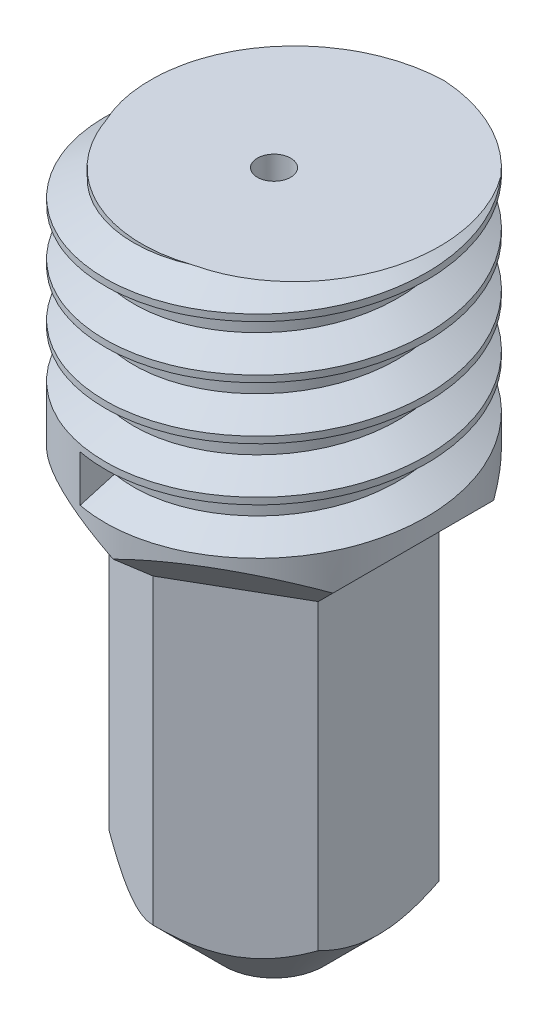
from build123d import *

# Parameters (mm, degrees)
SKETCH2_OUTSIDE_W  = 9.248
SKETCH2_OUTSIDE_H  = 9.248
CUT_EXTRUDE1_DEPTH = 7
CHAMFER2_SIZE      = 1.4
THREAD2_PITCH      = 0.79375


with BuildPart() as part:
    # Sketch1 → Revolve1 (revolve)
    with BuildSketch(Plane.XY, mode=Mode.PRIVATE) as revolve1_sk:
        Polygon((-0.25, 10), (-0.25, 0), (-0.75, 0), (-1.813, 1.063), (-1.813, 7), (-2.413, 7), (-2.413, 10), align=None)
    revolve(revolve1_sk.sketch.rotate(Axis((0, 0, 0), (0, 1, 0)), 270), axis=Axis((0, 0, 0), (0, 1, 0)))

    # Sketch2 outside → Cut-Extrude1 (cut)
    with BuildSketch(Plane.XZ):
        Rectangle(SKETCH2_OUTSIDE_W, SKETCH2_OUTSIDE_H)
        Polygon((0, 1.813), (-1.570104057, 0.9065), (-1.570104057, -0.9065), (0, -1.813), (1.570104057, -0.9065), (1.570104057, 0.9065), align=None, mode=Mode.SUBTRACT)
    extrude(amount=-CUT_EXTRUDE1_DEPTH, mode=Mode.SUBTRACT)

    # Chamfer2
    # the kernel refuses this chamfer: 1.4 mm, written as the material it adds along each edge
    with BuildSketch(Plane(origin=(4.688103974, 7, -0.893678092), x_dir=(0.4998109584556482, 0.02749587661058613, 0.8656979742248805), z_dir=(-0.8660254037844388, 0, 0.49999999999999983))) as chamfer2_piece_1_section:
        Polygon((CHAMFER2_SIZE * 0.999621916911, -CHAMFER2_SIZE * 0.0274958766106), (-CHAMFER2_SIZE * 0.0274958766106, -CHAMFER2_SIZE * 0.999621916911), (0, 0), align=None)
    chamfer2_piece_1 = extrude(amount=9.013712366, mode=Mode.PRIVATE)
    chamfer2_piece_1 = chamfer2_piece_1 & Plane(origin=(0, 6.446874687, 0), x_dir=(0, 0, -1), z_dir=(0, 1, 0)) * Cylinder(2.413, 24, mode=Mode.PRIVATE)
    chamfer2_piece_1 = split(chamfer2_piece_1, bisect_by=Plane(origin=(0.609740545, 6.446874687, 2.165033868), z_dir=(0.4999999999999998, 0, -0.8660254037844388)), keep=Keep.TOP, mode=Mode.PRIVATE)
    chamfer2_piece_1 = split(chamfer2_piece_1, bisect_by=Plane(origin=(1.570104057, 6.446874687, 1.610567736), z_dir=(-1, 0, 0)), keep=Keep.TOP, mode=Mode.PRIVATE)
    add(chamfer2_piece_1)
    with BuildSketch(Plane(origin=(3.117999917, 7, 3.613178092), x_dir=(-0.4998109584556481, 0.027495876610586115, 0.8656979742248805), z_dir=(-0.8660254037844388, 0, -0.4999999999999998))) as chamfer2_piece_2_section:
        Polygon((CHAMFER2_SIZE * 0.999621916911, -CHAMFER2_SIZE * 0.0274958766106), (-CHAMFER2_SIZE * 0.0274958766106, -CHAMFER2_SIZE * 0.999621916911), (0, 0), align=None)
    chamfer2_piece_2 = extrude(amount=9.013712366, mode=Mode.PRIVATE)
    chamfer2_piece_2 = chamfer2_piece_2 & Plane(origin=(0, 6.446874687, 0), x_dir=(0, 0, -1), z_dir=(0, 1, 0)) * Cylinder(2.413, 24, mode=Mode.PRIVATE)
    chamfer2_piece_2 = split(chamfer2_piece_2, bisect_by=Plane(origin=(-1.570104057, 6.446874687, 1.610567736), z_dir=(1, 0, 0)), keep=Keep.TOP, mode=Mode.PRIVATE)
    chamfer2_piece_2 = split(chamfer2_piece_2, bisect_by=Plane(origin=(-0.609740545, 6.446874687, 2.165033868), z_dir=(-0.49999999999999983, 0, -0.8660254037844388)), keep=Keep.TOP, mode=Mode.PRIVATE)
    add(chamfer2_piece_2)
    with BuildSketch(Plane(origin=(-1.570104057, 7, 4.506856183), x_dir=(-0.9996219169112968, 0.027495876610586115, 0), z_dir=(0, 0, -1))) as chamfer2_piece_3_section:
        Polygon((CHAMFER2_SIZE * 0.999621916911, -CHAMFER2_SIZE * 0.0274958766106), (-CHAMFER2_SIZE * 0.0274958766106, -CHAMFER2_SIZE * 0.999621916911), (0, 0), align=None)
    chamfer2_piece_3 = extrude(amount=9.013712366, mode=Mode.PRIVATE)
    chamfer2_piece_3 = chamfer2_piece_3 & Plane(origin=(0, 6.446874687, 0), x_dir=(0, 0, -1), z_dir=(0, 1, 0)) * Cylinder(2.413, 24, mode=Mode.PRIVATE)
    chamfer2_piece_3 = split(chamfer2_piece_3, bisect_by=Plane(origin=(-2.179844602, 6.446874687, -0.554466132), z_dir=(0.49999999999999956, 0, 0.8660254037844389)), keep=Keep.TOP, mode=Mode.PRIVATE)
    chamfer2_piece_3 = split(chamfer2_piece_3, bisect_by=Plane(origin=(-2.179844602, 6.446874687, 0.554466132), z_dir=(0.4999999999999998, 0, -0.8660254037844388)), keep=Keep.TOP, mode=Mode.PRIVATE)
    add(chamfer2_piece_3)
    with BuildSketch(Plane(origin=(-4.688103974, 7, 0.893678092), x_dir=(-0.49981095845564794, 0.027495876610586122, -0.8656979742248805), z_dir=(0.8660254037844389, 0, -0.49999999999999956))) as chamfer2_piece_4_section:
        Polygon((CHAMFER2_SIZE * 0.999621916911, -CHAMFER2_SIZE * 0.0274958766106), (-CHAMFER2_SIZE * 0.0274958766106, -CHAMFER2_SIZE * 0.999621916911), (0, 0), align=None)
    chamfer2_piece_4 = extrude(amount=9.013712366, mode=Mode.PRIVATE)
    chamfer2_piece_4 = chamfer2_piece_4 & Plane(origin=(0, 6.446874688, 0), x_dir=(0, 0, -1), z_dir=(0, 1, 0)) * Cylinder(2.413, 24, mode=Mode.PRIVATE)
    chamfer2_piece_4 = split(chamfer2_piece_4, bisect_by=Plane(origin=(-0.609740545, 6.446874688, -2.165033868), z_dir=(-0.4999999999999996, 0, 0.8660254037844389)), keep=Keep.TOP, mode=Mode.PRIVATE)
    chamfer2_piece_4 = split(chamfer2_piece_4, bisect_by=Plane(origin=(-1.570104057, 6.446874688, -1.610567735), z_dir=(1, 0, 0)), keep=Keep.TOP, mode=Mode.PRIVATE)
    add(chamfer2_piece_4)
    with BuildSketch(Plane(origin=(1.570104057, 7, -4.506856183), x_dir=(0.9996219169112968, 0.027495876610586115, 0), z_dir=(0, 0, 1))) as chamfer2_piece_5_section:
        Polygon((CHAMFER2_SIZE * 0.999621916911, -CHAMFER2_SIZE * 0.0274958766106), (-CHAMFER2_SIZE * 0.0274958766106, -CHAMFER2_SIZE * 0.999621916911), (0, 0), align=None)
    chamfer2_piece_5 = extrude(amount=9.013712366, mode=Mode.PRIVATE)
    chamfer2_piece_5 = chamfer2_piece_5 & Plane(origin=(0, 6.446874687, 0), x_dir=(0, 0, -1), z_dir=(0, 1, 0)) * Cylinder(2.413, 24, mode=Mode.PRIVATE)
    chamfer2_piece_5 = split(chamfer2_piece_5, bisect_by=Plane(origin=(2.179844602, 6.446874687, 0.554466132), z_dir=(-0.49999999999999983, 0, -0.8660254037844388)), keep=Keep.TOP, mode=Mode.PRIVATE)
    chamfer2_piece_5 = split(chamfer2_piece_5, bisect_by=Plane(origin=(2.179844602, 6.446874687, -0.554466132), z_dir=(-0.4999999999999996, 0, 0.8660254037844389)), keep=Keep.TOP, mode=Mode.PRIVATE)
    add(chamfer2_piece_5)
    with BuildSketch(Plane(origin=(-3.117999917, 7, -3.613178092), x_dir=(0.49981095845564794, 0.027495876610586112, -0.8656979742248806), z_dir=(0.8660254037844389, 0, 0.4999999999999996))) as chamfer2_piece_6_section:
        Polygon((CHAMFER2_SIZE * 0.999621916911, -CHAMFER2_SIZE * 0.0274958766106), (-CHAMFER2_SIZE * 0.0274958766106, -CHAMFER2_SIZE * 0.999621916911), (0, 0), align=None)
    chamfer2_piece_6 = extrude(amount=9.013712366, mode=Mode.PRIVATE)
    chamfer2_piece_6 = chamfer2_piece_6 & Plane(origin=(0, 6.446874688, 0), x_dir=(0, 0, -1), z_dir=(0, 1, 0)) * Cylinder(2.413, 24, mode=Mode.PRIVATE)
    chamfer2_piece_6 = split(chamfer2_piece_6, bisect_by=Plane(origin=(0.609740544, 6.446874688, -2.165033867), z_dir=(0.49999999999999956, 0, 0.8660254037844389)), keep=Keep.TOP, mode=Mode.PRIVATE)
    chamfer2_piece_6 = split(chamfer2_piece_6, bisect_by=Plane(origin=(1.570104057, 6.446874688, -1.610567736), z_dir=(-1, 0, 0)), keep=Keep.TOP, mode=Mode.PRIVATE)
    add(chamfer2_piece_6)
    with BuildSketch(Plane(origin=(4.688103974, 7, -0.893678092), x_dir=(0.4998109584556482, 0.02749587661058613, 0.8656979742248805), z_dir=(-0.8660254037844388, 0, 0.49999999999999983))) as chamfer2_piece_7a_section:
        Polygon((CHAMFER2_SIZE * 0.999621916911, -CHAMFER2_SIZE * 0.0274958766106), (-CHAMFER2_SIZE * 0.0274958766106, -CHAMFER2_SIZE * 0.999621916911), (0, 0), align=None)
    chamfer2_piece_7a = extrude(amount=9.013712366, mode=Mode.PRIVATE)
    chamfer2_piece_7a = chamfer2_piece_7a & Plane(origin=(0, 6.430993717, 0), x_dir=(0, 0, -1), z_dir=(0, 1, 0)) * Cylinder(2.413, 24, mode=Mode.PRIVATE)
    chamfer2_piece_7a = split(chamfer2_piece_7a, bisect_by=Plane(origin=(1.570104057, 6.430993717, 1.01029704), z_dir=(1, 0, 0)), keep=Keep.TOP, mode=Mode.PRIVATE)
    with BuildSketch(Plane(origin=(1.570104057, 7, -4.506856183), x_dir=(0.9996219169112968, 0.027495876610586115, 0), z_dir=(0, 0, 1))) as chamfer2_piece_7b_section:
        Polygon((CHAMFER2_SIZE * 0.999621916911, -CHAMFER2_SIZE * 0.0274958766106), (-CHAMFER2_SIZE * 0.0274958766106, -CHAMFER2_SIZE * 0.999621916911), (0, 0), align=None)
    chamfer2_piece_7b = extrude(amount=9.013712366, mode=Mode.PRIVATE)
    chamfer2_piece_7b = chamfer2_piece_7b & Plane(origin=(0, 6.430993714, 0), x_dir=(0, 0, -1), z_dir=(0, 1, 0)) * Cylinder(2.413, 24, mode=Mode.PRIVATE)
    chamfer2_piece_7b = split(chamfer2_piece_7b, bisect_by=Plane(origin=(1.65999493, 6.430993714, 0.85460148), z_dir=(0.49999999999999983, 0, 0.8660254037844388)), keep=Keep.TOP, mode=Mode.PRIVATE)
    chamfer2_piece_7 = chamfer2_piece_7a & chamfer2_piece_7b
    add(chamfer2_piece_7)
    with BuildSketch(Plane(origin=(3.117999917, 7, 3.613178092), x_dir=(-0.4998109584556481, 0.027495876610586115, 0.8656979742248805), z_dir=(-0.8660254037844388, 0, -0.4999999999999998))) as chamfer2_piece_8a_section:
        Polygon((CHAMFER2_SIZE * 0.999621916911, -CHAMFER2_SIZE * 0.0274958766106), (-CHAMFER2_SIZE * 0.0274958766106, -CHAMFER2_SIZE * 0.999621916911), (0, 0), align=None)
    chamfer2_piece_8a = extrude(amount=9.013712366, mode=Mode.PRIVATE)
    chamfer2_piece_8a = chamfer2_piece_8a & Plane(origin=(0, 6.430993717, 0), x_dir=(0, 0, -1), z_dir=(0, 1, 0)) * Cylinder(2.413, 24, mode=Mode.PRIVATE)
    chamfer2_piece_8a = split(chamfer2_piece_8a, bisect_by=Plane(origin=(-0.089890874, 6.430993717, 1.86489852), z_dir=(0.49999999999999983, 0, 0.8660254037844388)), keep=Keep.TOP, mode=Mode.PRIVATE)
    with BuildSketch(Plane(origin=(4.688103974, 7, -0.893678092), x_dir=(0.4998109584556482, 0.02749587661058613, 0.8656979742248805), z_dir=(-0.8660254037844388, 0, 0.49999999999999983))) as chamfer2_piece_8b_section:
        Polygon((CHAMFER2_SIZE * 0.999621916911, -CHAMFER2_SIZE * 0.0274958766106), (-CHAMFER2_SIZE * 0.0274958766106, -CHAMFER2_SIZE * 0.999621916911), (0, 0), align=None)
    chamfer2_piece_8b = extrude(amount=9.013712366, mode=Mode.PRIVATE)
    chamfer2_piece_8b = chamfer2_piece_8b & Plane(origin=(0, 6.430993714, 0), x_dir=(0, 0, -1), z_dir=(0, 1, 0)) * Cylinder(2.413, 24, mode=Mode.PRIVATE)
    chamfer2_piece_8b = split(chamfer2_piece_8b, bisect_by=Plane(origin=(0.089890873, 6.430993714, 1.864898519), z_dir=(-0.4999999999999998, 0, 0.8660254037844388)), keep=Keep.TOP, mode=Mode.PRIVATE)
    chamfer2_piece_8 = chamfer2_piece_8a & chamfer2_piece_8b
    add(chamfer2_piece_8)
    with BuildSketch(Plane(origin=(-1.570104057, 7, 4.506856183), x_dir=(-0.9996219169112968, 0.027495876610586115, 0), z_dir=(0, 0, -1))) as chamfer2_piece_9a_section:
        Polygon((CHAMFER2_SIZE * 0.999621916911, -CHAMFER2_SIZE * 0.0274958766106), (-CHAMFER2_SIZE * 0.0274958766106, -CHAMFER2_SIZE * 0.999621916911), (0, 0), align=None)
    chamfer2_piece_9a = extrude(amount=9.013712366, mode=Mode.PRIVATE)
    chamfer2_piece_9a = chamfer2_piece_9a & Plane(origin=(0, 6.430993706, 0), x_dir=(0, 0, -1), z_dir=(0, 1, 0)) * Cylinder(2.413, 24, mode=Mode.PRIVATE)
    chamfer2_piece_9a = split(chamfer2_piece_9a, bisect_by=Plane(origin=(-1.659994936, 6.430993706, 0.854601477), z_dir=(-0.4999999999999998, 0, 0.8660254037844388)), keep=Keep.TOP, mode=Mode.PRIVATE)
    with BuildSketch(Plane(origin=(3.117999917, 7, 3.613178092), x_dir=(-0.4998109584556481, 0.027495876610586115, 0.8656979742248805), z_dir=(-0.8660254037844388, 0, -0.4999999999999998))) as chamfer2_piece_9b_section:
        Polygon((CHAMFER2_SIZE * 0.999621916911, -CHAMFER2_SIZE * 0.0274958766106), (-CHAMFER2_SIZE * 0.0274958766106, -CHAMFER2_SIZE * 0.999621916911), (0, 0), align=None)
    chamfer2_piece_9b = extrude(amount=9.013712366, mode=Mode.PRIVATE)
    chamfer2_piece_9b = chamfer2_piece_9b & Plane(origin=(0, 6.430993714, 0), x_dir=(0, 0, -1), z_dir=(0, 1, 0)) * Cylinder(2.413, 24, mode=Mode.PRIVATE)
    chamfer2_piece_9b = split(chamfer2_piece_9b, bisect_by=Plane(origin=(-1.570104057, 6.430993714, 1.010297039), z_dir=(-1, 0, 0)), keep=Keep.TOP, mode=Mode.PRIVATE)
    chamfer2_piece_9 = chamfer2_piece_9a & chamfer2_piece_9b
    add(chamfer2_piece_9)
    with BuildSketch(Plane(origin=(-4.688103974, 7, 0.893678092), x_dir=(-0.49981095845564794, 0.027495876610586122, -0.8656979742248805), z_dir=(0.8660254037844389, 0, -0.49999999999999956))) as chamfer2_piece_10a_section:
        Polygon((CHAMFER2_SIZE * 0.999621916911, -CHAMFER2_SIZE * 0.0274958766106), (-CHAMFER2_SIZE * 0.0274958766106, -CHAMFER2_SIZE * 0.999621916911), (0, 0), align=None)
    chamfer2_piece_10a = extrude(amount=9.013712366, mode=Mode.PRIVATE)
    chamfer2_piece_10a = chamfer2_piece_10a & Plane(origin=(0, 6.430993717, 0), x_dir=(0, 0, -1), z_dir=(0, 1, 0)) * Cylinder(2.413, 24, mode=Mode.PRIVATE)
    chamfer2_piece_10a = split(chamfer2_piece_10a, bisect_by=Plane(origin=(-1.570104057, 6.430993717, -1.01029704), z_dir=(-1, 0, 0)), keep=Keep.TOP, mode=Mode.PRIVATE)
    with BuildSketch(Plane(origin=(-1.570104057, 7, 4.506856183), x_dir=(-0.9996219169112968, 0.027495876610586115, 0), z_dir=(0, 0, -1))) as chamfer2_piece_10b_section:
        Polygon((CHAMFER2_SIZE * 0.999621916911, -CHAMFER2_SIZE * 0.0274958766106), (-CHAMFER2_SIZE * 0.0274958766106, -CHAMFER2_SIZE * 0.999621916911), (0, 0), align=None)
    chamfer2_piece_10b = extrude(amount=9.013712366, mode=Mode.PRIVATE)
    chamfer2_piece_10b = chamfer2_piece_10b & Plane(origin=(0, 6.430993714, 0), x_dir=(0, 0, -1), z_dir=(0, 1, 0)) * Cylinder(2.413, 24, mode=Mode.PRIVATE)
    chamfer2_piece_10b = split(chamfer2_piece_10b, bisect_by=Plane(origin=(-1.65999493, 6.430993714, -0.85460148), z_dir=(-0.49999999999999956, 0, -0.8660254037844389)), keep=Keep.TOP, mode=Mode.PRIVATE)
    chamfer2_piece_10 = chamfer2_piece_10a & chamfer2_piece_10b
    add(chamfer2_piece_10)
    with BuildSketch(Plane(origin=(-4.688103974, 7, 0.893678092), x_dir=(-0.49981095845564794, 0.027495876610586122, -0.8656979742248805), z_dir=(0.8660254037844389, 0, -0.49999999999999956))) as chamfer2_piece_11a_section:
        Polygon((CHAMFER2_SIZE * 0.999621916911, -CHAMFER2_SIZE * 0.0274958766106), (-CHAMFER2_SIZE * 0.0274958766106, -CHAMFER2_SIZE * 0.999621916911), (0, 0), align=None)
    chamfer2_piece_11a = extrude(amount=9.013712366, mode=Mode.PRIVATE)
    chamfer2_piece_11a = chamfer2_piece_11a & Plane(origin=(0, 6.430993701, 0), x_dir=(0, 0, -1), z_dir=(0, 1, 0)) * Cylinder(2.413, 24, mode=Mode.PRIVATE)
    chamfer2_piece_11a = split(chamfer2_piece_11a, bisect_by=Plane(origin=(-0.089890872, 6.430993701, -1.864898519), z_dir=(0.4999999999999996, 0, -0.8660254037844389)), keep=Keep.TOP, mode=Mode.PRIVATE)
    with BuildSketch(Plane(origin=(-3.117999917, 7, -3.613178092), x_dir=(0.49981095845564794, 0.027495876610586112, -0.8656979742248806), z_dir=(0.8660254037844389, 0, 0.4999999999999996))) as chamfer2_piece_11b_section:
        Polygon((CHAMFER2_SIZE * 0.999621916911, -CHAMFER2_SIZE * 0.0274958766106), (-CHAMFER2_SIZE * 0.0274958766106, -CHAMFER2_SIZE * 0.999621916911), (0, 0), align=None)
    chamfer2_piece_11b = extrude(amount=9.013712366, mode=Mode.PRIVATE)
    chamfer2_piece_11b = chamfer2_piece_11b & Plane(origin=(0, 6.4309937, 0), x_dir=(0, 0, -1), z_dir=(0, 1, 0)) * Cylinder(2.413, 24, mode=Mode.PRIVATE)
    chamfer2_piece_11b = split(chamfer2_piece_11b, bisect_by=Plane(origin=(0.089890872, 6.4309937, -1.864898519), z_dir=(-0.49999999999999956, 0, -0.8660254037844389)), keep=Keep.TOP, mode=Mode.PRIVATE)
    chamfer2_piece_11 = chamfer2_piece_11a & chamfer2_piece_11b
    add(chamfer2_piece_11)
    with BuildSketch(Plane(origin=(1.570104057, 7, -4.506856183), x_dir=(0.9996219169112968, 0.027495876610586115, 0), z_dir=(0, 0, 1))) as chamfer2_piece_12a_section:
        Polygon((CHAMFER2_SIZE * 0.999621916911, -CHAMFER2_SIZE * 0.0274958766106), (-CHAMFER2_SIZE * 0.0274958766106, -CHAMFER2_SIZE * 0.999621916911), (0, 0), align=None)
    chamfer2_piece_12a = extrude(amount=9.013712366, mode=Mode.PRIVATE)
    chamfer2_piece_12a = chamfer2_piece_12a & Plane(origin=(0, 6.430993706, 0), x_dir=(0, 0, -1), z_dir=(0, 1, 0)) * Cylinder(2.413, 24, mode=Mode.PRIVATE)
    chamfer2_piece_12a = split(chamfer2_piece_12a, bisect_by=Plane(origin=(1.659994936, 6.430993706, -0.854601477), z_dir=(0.4999999999999996, 0, -0.8660254037844389)), keep=Keep.TOP, mode=Mode.PRIVATE)
    with BuildSketch(Plane(origin=(-3.117999917, 7, -3.613178092), x_dir=(0.49981095845564794, 0.027495876610586112, -0.8656979742248806), z_dir=(0.8660254037844389, 0, 0.4999999999999996))) as chamfer2_piece_12b_section:
        Polygon((CHAMFER2_SIZE * 0.999621916911, -CHAMFER2_SIZE * 0.0274958766106), (-CHAMFER2_SIZE * 0.0274958766106, -CHAMFER2_SIZE * 0.999621916911), (0, 0), align=None)
    chamfer2_piece_12b = extrude(amount=9.013712366, mode=Mode.PRIVATE)
    chamfer2_piece_12b = chamfer2_piece_12b & Plane(origin=(0, 6.430993715, 0), x_dir=(0, 0, -1), z_dir=(0, 1, 0)) * Cylinder(2.413, 24, mode=Mode.PRIVATE)
    chamfer2_piece_12b = split(chamfer2_piece_12b, bisect_by=Plane(origin=(1.570104057, 6.430993715, -1.010297039), z_dir=(1, 0, 0)), keep=Keep.TOP, mode=Mode.PRIVATE)
    chamfer2_piece_12 = chamfer2_piece_12a & chamfer2_piece_12b
    add(chamfer2_piece_12)

    # Thread2: the profile of Thread Profile2 profile screwed along a right-hand helix of 4.787402 turns, 8 arcs to a turn; built about Z, then put on its axis
    thread2_z = Axis((0, 0, 0), (0, 0, 1))
    thread2_corners = [(2.4133, 0, -0.000173205), (2.4133, 0, 0.694704453), (1.983370212, 0, 0.446484374), (1.983370212, 0, 0.248046874)]
    with BuildLine(mode=Mode.PRIVATE) as thread2_profile:
        Line(thread2_corners[0], thread2_corners[1])
        Line(thread2_corners[1], thread2_corners[2])
        Line(thread2_corners[2], thread2_corners[3])
        Line(thread2_corners[3], thread2_corners[0])
    thread2_cap = Face(thread2_profile.wire())
    thread2_turn_angles = [0, 22.5, 45, 67.5, 90, 112.5, 135, 157.5, 180, 202.5, 225, 247.5, 270, 292.5, 315, 337.5, 360]
    thread2_turn_weights = [1, 0.9238795325112867, 1, 0.9238795325112867, 1, 0.9238795325112867, 1, 0.9238795325112867, 1, 0.9238795325112867, 1, 0.9238795325112867, 1, 0.9238795325112867, 1, 0.9238795325112867, 1]
    thread2_turn_rails = [Edge.make_bspline([Vector(p[0], p[1], 0).rotate(thread2_z, thread2_turn_angles[k]) / thread2_turn_weights[k] + Vector(0, 0, p[2] + THREAD2_PITCH * thread2_turn_angles[k] / 360) for k in range(17)], [0, 0, 0, 1, 1, 2, 2, 3, 3, 4, 4, 5, 5, 6, 6, 7, 7, 8, 8, 8], 2, thread2_turn_weights) for p in thread2_corners]
    thread2_turn_sides = [Face.make_surface_from_curves(thread2_turn_rails[p[0]], thread2_turn_rails[p[1]]) for p in [(0, 1), (1, 2), (2, 3), (3, 0)]]
    thread2_last_angles = [1440, 1462.5, 1485, 1507.5, 1530, 1552.5, 1575, 1597.5, 1620, 1642.5, 1665, 1687.5, 1710, 1716.732283465, 1723.464566929]
    thread2_last_weights = [1, 0.9238795325112867, 1, 0.9238795325112867, 1, 0.9238795325112867, 1, 0.9238795325112867, 1, 0.9238795325112867, 1, 0.9238795325112867, 1, 0.9931047534388169, 1]
    thread2_last_rails = [Edge.make_bspline([Vector(p[0], p[1], 0).rotate(thread2_z, thread2_last_angles[k]) / thread2_last_weights[k] + Vector(0, 0, p[2] + THREAD2_PITCH * thread2_last_angles[k] / 360) for k in range(15)], [0, 0, 0, 1, 1, 2, 2, 3, 3, 4, 4, 5, 5, 6, 6, 7, 7, 7], 2, thread2_last_weights) for p in thread2_corners]
    thread2_last_sides = [Face.make_surface_from_curves(thread2_last_rails[p[0]], thread2_last_rails[p[1]]) for p in [(0, 1), (1, 2), (2, 3), (3, 0)]]
    thread2 = Plane(origin=(0, 11, 0), x_dir=(-1, 0, 0), z_dir=(0, -1, 0)) * Solid(Shell([*[p.moved(Location((0, 0, THREAD2_PITCH * i))) for i in range(4) for p in thread2_turn_sides], *thread2_last_sides, thread2_cap, thread2_cap.rotate(thread2_z, 1723.464566929).moved(Location((0, 0, THREAD2_PITCH * 1723.464566929 / 360)))]))
    add(thread2, mode=Mode.SUBTRACT)


solid = part.part
